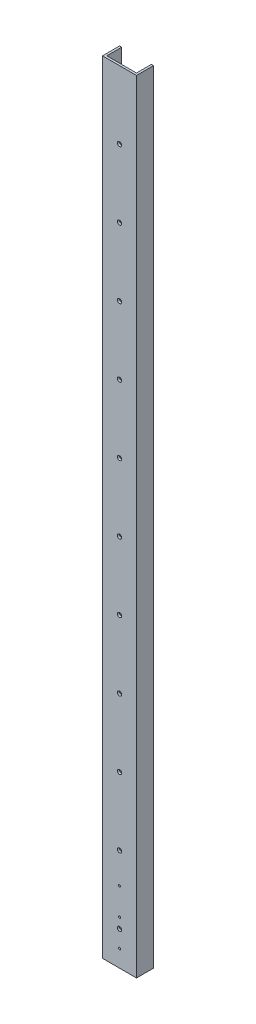
from build123d import *

# Parameters (mm, degrees)
BOSS_EXTRUDE1_DEPTH = 1168.4
CUT_EXTRUDE1_REACH  = 1171.78
SKETCH2_R           = 3.175
CUT_EXTRUDE2_REACH  = 1171.715
SKETCH3_R           = 1.5875


with BuildPart() as part:
    # Sketch1 → Boss-Extrude1 (new body)
    with BuildSketch(Plane(origin=(0, 0, 0), x_dir=(1, 0, 0), z_dir=(0, 1, 0))):
        Polygon((3.175, 3.175), (3.175, 25.4), (0, 25.4), (0, 0), (50.8, 0), (50.8, 25.4), (47.625, 25.4), (47.625, 3.175), align=None)
    extrude(amount=BOSS_EXTRUDE1_DEPTH)

    # Sketch2 → Cut-Extrude1 (cut, up to next)
    with BuildSketch(Plane.XY, mode=Mode.PRIVATE) as cut_extrude1_sk1:
        with Locations((25.4, 50.8)):
            Circle(SKETCH2_R)
    cut_extrude1_tool1 = extrude(cut_extrude1_sk1.sketch, amount=-CUT_EXTRUDE1_REACH, mode=Mode.PRIVATE) & part.part
    # Sketch2 → Cut-Extrude1 (cut, up to next)
    with BuildSketch(Plane.XY, mode=Mode.PRIVATE) as cut_extrude1_sk2:
        with Locations((25.4, 152.4)):
            Circle(SKETCH2_R)
    cut_extrude1_tool2 = extrude(cut_extrude1_sk2.sketch, amount=-CUT_EXTRUDE1_REACH, mode=Mode.PRIVATE) & part.part
    # Sketch2 → Cut-Extrude1 (cut, up to next)
    with BuildSketch(Plane.XY, mode=Mode.PRIVATE) as cut_extrude1_sk3:
        with Locations((25.4, 254)):
            Circle(SKETCH2_R)
    cut_extrude1_tool3 = extrude(cut_extrude1_sk3.sketch, amount=-CUT_EXTRUDE1_REACH, mode=Mode.PRIVATE) & part.part
    # Sketch2 → Cut-Extrude1 (cut, up to next)
    with BuildSketch(Plane.XY, mode=Mode.PRIVATE) as cut_extrude1_sk4:
        with Locations((25.4, 355.6)):
            Circle(SKETCH2_R)
    cut_extrude1_tool4 = extrude(cut_extrude1_sk4.sketch, amount=-CUT_EXTRUDE1_REACH, mode=Mode.PRIVATE) & part.part
    # Sketch2 → Cut-Extrude1 (cut, up to next)
    with BuildSketch(Plane.XY, mode=Mode.PRIVATE) as cut_extrude1_sk5:
        with Locations((25.4, 457.2)):
            Circle(SKETCH2_R)
    cut_extrude1_tool5 = extrude(cut_extrude1_sk5.sketch, amount=-CUT_EXTRUDE1_REACH, mode=Mode.PRIVATE) & part.part
    # Sketch2 → Cut-Extrude1 (cut, up to next)
    with BuildSketch(Plane.XY, mode=Mode.PRIVATE) as cut_extrude1_sk6:
        with Locations((25.4, 558.8)):
            Circle(SKETCH2_R)
    cut_extrude1_tool6 = extrude(cut_extrude1_sk6.sketch, amount=-CUT_EXTRUDE1_REACH, mode=Mode.PRIVATE) & part.part
    # Sketch2 → Cut-Extrude1 (cut, up to next)
    with BuildSketch(Plane.XY, mode=Mode.PRIVATE) as cut_extrude1_sk7:
        with Locations((25.4, 660.4)):
            Circle(SKETCH2_R)
    cut_extrude1_tool7 = extrude(cut_extrude1_sk7.sketch, amount=-CUT_EXTRUDE1_REACH, mode=Mode.PRIVATE) & part.part
    # Sketch2 → Cut-Extrude1 (cut, up to next)
    with BuildSketch(Plane.XY, mode=Mode.PRIVATE) as cut_extrude1_sk8:
        with Locations((25.4, 762)):
            Circle(SKETCH2_R)
    cut_extrude1_tool8 = extrude(cut_extrude1_sk8.sketch, amount=-CUT_EXTRUDE1_REACH, mode=Mode.PRIVATE) & part.part
    # Sketch2 → Cut-Extrude1 (cut, up to next)
    with BuildSketch(Plane.XY, mode=Mode.PRIVATE) as cut_extrude1_sk9:
        with Locations((25.4, 863.6)):
            Circle(SKETCH2_R)
    cut_extrude1_tool9 = extrude(cut_extrude1_sk9.sketch, amount=-CUT_EXTRUDE1_REACH, mode=Mode.PRIVATE) & part.part
    # Sketch2 → Cut-Extrude1 (cut, up to next)
    with BuildSketch(Plane.XY, mode=Mode.PRIVATE) as cut_extrude1_sk10:
        with Locations((25.4, 965.2)):
            Circle(SKETCH2_R)
    cut_extrude1_tool10 = extrude(cut_extrude1_sk10.sketch, amount=-CUT_EXTRUDE1_REACH, mode=Mode.PRIVATE) & part.part
    # Sketch2 → Cut-Extrude1 (cut, up to next)
    with BuildSketch(Plane.XY, mode=Mode.PRIVATE) as cut_extrude1_sk11:
        with Locations((25.4, 1066.8)):
            Circle(SKETCH2_R)
    cut_extrude1_tool11 = extrude(cut_extrude1_sk11.sketch, amount=-CUT_EXTRUDE1_REACH, mode=Mode.PRIVATE) & part.part
    add(cut_extrude1_tool1.solids().sort_by_distance((25.4, 50.8, 0))[0], mode=Mode.SUBTRACT)
    add(cut_extrude1_tool2.solids().sort_by_distance((25.4, 152.4, 0))[0], mode=Mode.SUBTRACT)
    add(cut_extrude1_tool3.solids().sort_by_distance((25.4, 254, 0))[0], mode=Mode.SUBTRACT)
    add(cut_extrude1_tool4.solids().sort_by_distance((25.4, 355.6, 0))[0], mode=Mode.SUBTRACT)
    add(cut_extrude1_tool5.solids().sort_by_distance((25.4, 457.2, 0))[0], mode=Mode.SUBTRACT)
    add(cut_extrude1_tool6.solids().sort_by_distance((25.4, 558.8, 0))[0], mode=Mode.SUBTRACT)
    add(cut_extrude1_tool7.solids().sort_by_distance((25.4, 660.4, 0))[0], mode=Mode.SUBTRACT)
    add(cut_extrude1_tool8.solids().sort_by_distance((25.4, 762, 0))[0], mode=Mode.SUBTRACT)
    add(cut_extrude1_tool9.solids().sort_by_distance((25.4, 863.6, 0))[0], mode=Mode.SUBTRACT)
    add(cut_extrude1_tool10.solids().sort_by_distance((25.4, 965.2, 0))[0], mode=Mode.SUBTRACT)
    add(cut_extrude1_tool11.solids().sort_by_distance((25.4, 1066.8, 0))[0], mode=Mode.SUBTRACT)

    # Sketch3 → Cut-Extrude2 (cut, up to next)
    with BuildSketch(Plane(origin=(0, 0, -3.175), x_dir=(-1, 0, 0), z_dir=(0, 0, -1)), mode=Mode.PRIVATE) as cut_extrude2_sk1:
        with Locations((-25.4, 25.4)):
            Circle(SKETCH3_R)
    cut_extrude2_tool1 = extrude(cut_extrude2_sk1.sketch, amount=-CUT_EXTRUDE2_REACH, mode=Mode.PRIVATE) & part.part
    # Sketch3 → Cut-Extrude2 (cut, up to next)
    with BuildSketch(Plane(origin=(0, 0, -3.175), x_dir=(-1, 0, 0), z_dir=(0, 0, -1)), mode=Mode.PRIVATE) as cut_extrude2_sk2:
        with Locations((-25.4, 66.020295879)):
            Circle(SKETCH3_R)
    cut_extrude2_tool2 = extrude(cut_extrude2_sk2.sketch, amount=-CUT_EXTRUDE2_REACH, mode=Mode.PRIVATE) & part.part
    # Sketch3 → Cut-Extrude2 (cut, up to next)
    with BuildSketch(Plane(origin=(0, 0, -3.175), x_dir=(-1, 0, 0), z_dir=(0, 0, -1)), mode=Mode.PRIVATE) as cut_extrude2_sk3:
        with Locations((-25.4, 106.640591758)):
            Circle(SKETCH3_R)
    cut_extrude2_tool3 = extrude(cut_extrude2_sk3.sketch, amount=-CUT_EXTRUDE2_REACH, mode=Mode.PRIVATE) & part.part
    add(cut_extrude2_tool1.solids().sort_by_distance((25.4, 25.4, -3.175))[0], mode=Mode.SUBTRACT)
    add(cut_extrude2_tool2.solids().sort_by_distance((25.4, 66.020296, -3.175))[0], mode=Mode.SUBTRACT)
    add(cut_extrude2_tool3.solids().sort_by_distance((25.4, 106.640592, -3.175))[0], mode=Mode.SUBTRACT)


solid = part.part
